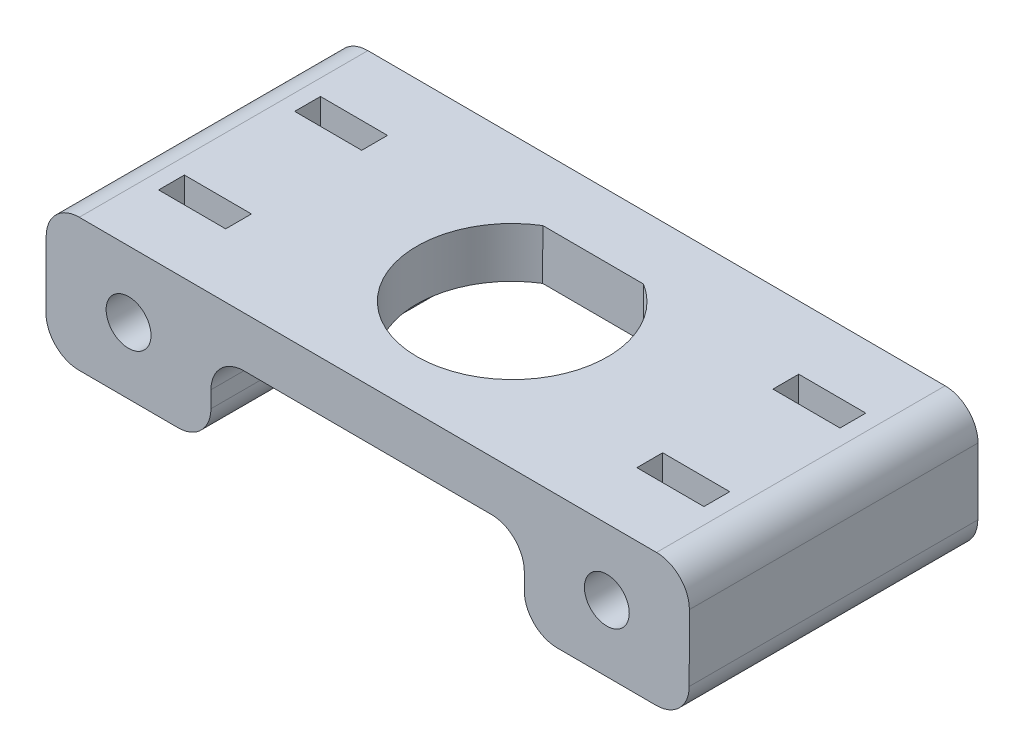
from build123d import *

# Parameters (mm, degrees)
BOSS_EXTRUDE1_DEPTH   = 22.225
CUT_EXTRUDE1_REACH    = 101.546
FILLET1_R             = 2.54
F_4_CLEARANCE_HOLE1_D = 3.4544
SKETCH6_W             = 5.1625
SKETCH6_H             = 1.9875
CUT_EXTRUDE2_DEPTH    = 8.255


with BuildPart() as part:
    # Sketch1 → Boss-Extrude1 (new body)
    with BuildSketch(Plane.XY):
        Polygon((-96.82388635, -119.84135975), (-47.294090685, -119.983632078), (-47.323432737, -130.198589936), (-60.023380343, -130.162109852), (-60.005140301, -123.812136049), (-84.135040753, -123.742823889), (-84.153280795, -130.092797692), (-96.853228402, -130.056317608), align=None)
    extrude(amount=BOSS_EXTRUDE1_DEPTH)

    # Sketch2 → Cut-Extrude1 (cut, up to next)
    with BuildSketch(Plane(origin=(-0.345035492, -120.118491334, 0), x_dir=(0.999995874513973, -0.0028724475686203272, 0), z_dir=(0.0028724475686203272, 0.999995874513973, 0)), mode=Mode.PRIVATE) as cut_extrude1_sk1:
        with BuildLine():
            Line((-67.837073069, -4.8775), (-75.591424695, -4.8775))
            ThreePointArc((-75.591424695, -4.8775), (-71.714248882, -18.4546875), (-67.837073069, -4.8775))
        make_face()
    cut_extrude1_tool1 = extrude(cut_extrude1_sk1.sketch, amount=-CUT_EXTRUDE1_REACH, mode=Mode.PRIVATE) & part.part
    add(cut_extrude1_tool1.solids().sort_by_distance((-72.058989, -119.912496, 11.350092))[0], mode=Mode.SUBTRACT)

    # Fillet1
    fillet1_edges = [part.edges().sort_by_distance(p)[0] for p in [
        (-47.294090685, -119.983632078, 11.1125),
        (-47.323432737, -130.198589936, 11.1125),
        (-60.023380343, -130.162109852, 11.1125),
        (-96.82388635, -119.84135975, 11.1125),
        (-96.853228402, -130.056317608, 11.1125),
        (-84.153280795, -130.092797692, 11.1125),
        (-60.005140301, -123.812136049, 11.1125),
        (-84.135040753, -123.742823889, 11.1125),
    ]]
    fillet(fillet1_edges, radius=FILLET1_R)

    # #4 Clearance Hole1 (through all)
    with Locations(Plane.XY.offset(22.225)):
        with Locations((-90.488583573, -124.967078721), (-53.658735514, -125.072870965)):
            Hole(F_4_CLEARANCE_HOLE1_D / 2)

    # Sketch6 → Cut-Extrude2 (cut)
    with BuildSketch(Plane(origin=(-0.345035492, -120.118491334, 0), x_dir=(0.999995874513973, -0.002872447568619416, 0), z_dir=(0.002872447568619416, 0.999995874513973, 0))):
        with Locations((-90.129248882, -16.35125)):
            Rectangle(SKETCH6_W, SKETCH6_H)
        with Locations((-90.129248882, -5.87375)):
            Rectangle(SKETCH6_W, SKETCH6_H)
        with Locations((-53.299248882, -5.87375)):
            Rectangle(SKETCH6_W, SKETCH6_H)
        with Locations((-53.299248882, -16.35125)):
            Rectangle(SKETCH6_W, SKETCH6_H)
    extrude(amount=-CUT_EXTRUDE2_DEPTH, mode=Mode.SUBTRACT)


solid = part.part
